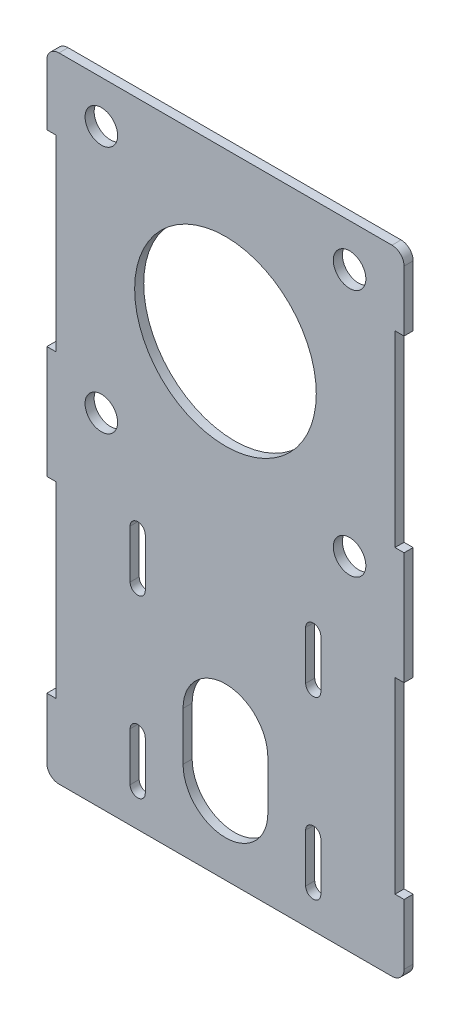
from build123d import *

# Parameters (mm, degrees)
SKETCH1_W          = 187.325
SKETCH1_H          = 332.057083461
EXTRUDE1_DEPTH     = 4.7625
CUT_EXTRUDE1_REACH = 264.098
CUT_EXTRUDE2_REACH = 264.098
SKETCH3_R          = 47.625
SKETCH3_R_2        = 8.5328125
FILLET1_R          = 6.35
CUT_EXTRUDE3_REACH = 264.098
SKETCH4_W          = 4.7625
SKETCH4_H          = 98.425


with BuildPart() as part:
    # Sketch1 → Extrude1 (new body)
    with BuildSketch(Plane.XY):
        with Locations((0, -78.716041731)):
            Rectangle(SKETCH1_W, SKETCH1_H)
    extrude(amount=-EXTRUDE1_DEPTH)

    # Sketch2 → Cut-Extrude1 (cut, up to next)
    with BuildSketch(Plane.XY, mode=Mode.PRIVATE) as cut_extrude1_sk1:
        with BuildLine():
            Line((-22.225, -203.2), (-22.225, -177.8))
            ThreePointArc((-22.225, -177.8), (0, -155.575), (22.225, -177.8))
            Line((22.225, -177.8), (22.225, -203.2))
            ThreePointArc((22.225, -203.2), (0, -225.425), (-22.225, -203.2))
        make_face()
    cut_extrude1_tool1 = extrude(cut_extrude1_sk1.sketch, amount=-CUT_EXTRUDE1_REACH, mode=Mode.PRIVATE) & part.part
    # Sketch2 → Cut-Extrude1 (cut, up to next)
    with BuildSketch(Plane.XY, mode=Mode.PRIVATE) as cut_extrude1_sk2:
        with BuildLine():
            Line((49.99355, -108.9152), (49.99355, -134.3152))
            ThreePointArc((49.99355, -134.3152), (46.0248, -138.28395), (42.05605, -134.3152))
            Line((42.05605, -134.3152), (42.05605, -108.9152))
            ThreePointArc((42.05605, -108.9152), (46.0248, -104.94645), (49.99355, -108.9152))
        make_face()
    cut_extrude1_tool2 = extrude(cut_extrude1_sk2.sketch, amount=-CUT_EXTRUDE1_REACH, mode=Mode.PRIVATE) & part.part
    # Sketch2 → Cut-Extrude1 (cut, up to next)
    with BuildSketch(Plane.XY, mode=Mode.PRIVATE) as cut_extrude1_sk3:
        with BuildLine():
            Line((-42.05605, -108.9152), (-42.05605, -134.3152))
            ThreePointArc((-42.05605, -134.3152), (-46.0248, -138.28395), (-49.99355, -134.3152))
            Line((-49.99355, -134.3152), (-49.99355, -108.9152))
            ThreePointArc((-49.99355, -108.9152), (-46.0248, -104.94645), (-42.05605, -108.9152))
        make_face()
    cut_extrude1_tool3 = extrude(cut_extrude1_sk3.sketch, amount=-CUT_EXTRUDE1_REACH, mode=Mode.PRIVATE) & part.part
    # Sketch2 → Cut-Extrude1 (cut, up to next)
    with BuildSketch(Plane.XY, mode=Mode.PRIVATE) as cut_extrude1_sk4:
        with BuildLine():
            Line((49.99355, -200.9648), (49.99355, -226.3648))
            ThreePointArc((49.99355, -226.3648), (46.0248, -230.33355), (42.05605, -226.3648))
            Line((42.05605, -226.3648), (42.05605, -200.9648))
            ThreePointArc((42.05605, -200.9648), (46.0248, -196.99605), (49.99355, -200.9648))
        make_face()
    cut_extrude1_tool4 = extrude(cut_extrude1_sk4.sketch, amount=-CUT_EXTRUDE1_REACH, mode=Mode.PRIVATE) & part.part
    # Sketch2 → Cut-Extrude1 (cut, up to next)
    with BuildSketch(Plane.XY, mode=Mode.PRIVATE) as cut_extrude1_sk5:
        with BuildLine():
            Line((-42.05605, -200.9648), (-42.05605, -226.3648))
            ThreePointArc((-42.05605, -226.3648), (-46.0248, -230.33355), (-49.99355, -226.3648))
            Line((-49.99355, -226.3648), (-49.99355, -200.9648))
            ThreePointArc((-49.99355, -200.9648), (-46.0248, -196.99605), (-42.05605, -200.9648))
        make_face()
    cut_extrude1_tool5 = extrude(cut_extrude1_sk5.sketch, amount=-CUT_EXTRUDE1_REACH, mode=Mode.PRIVATE) & part.part
    add(cut_extrude1_tool1.solids().sort_by_distance((0, -190.5, 0))[0], mode=Mode.SUBTRACT)
    add(cut_extrude1_tool2.solids().sort_by_distance((46.0248, -121.6152, 0))[0], mode=Mode.SUBTRACT)
    add(cut_extrude1_tool3.solids().sort_by_distance((-46.0248, -121.6152, 0))[0], mode=Mode.SUBTRACT)
    add(cut_extrude1_tool4.solids().sort_by_distance((46.0248, -213.6648, 0))[0], mode=Mode.SUBTRACT)
    add(cut_extrude1_tool5.solids().sort_by_distance((-46.0248, -213.6648, 0))[0], mode=Mode.SUBTRACT)

    # Sketch3 → Cut-Extrude2 (cut, up to next)
    with BuildSketch(Plane(origin=(0, 0, 0), x_dir=(-1, 0, 0), z_dir=(0, 0, -1)), mode=Mode.PRIVATE) as cut_extrude2_sk1:
        Circle(SKETCH3_R)
    cut_extrude2_tool1 = extrude(cut_extrude2_sk1.sketch, amount=CUT_EXTRUDE2_REACH, mode=Mode.PRIVATE) & part.part
    # Sketch3 → Cut-Extrude2 (cut, up to next)
    with BuildSketch(Plane(origin=(0, 0, 0), x_dir=(-1, 0, 0), z_dir=(0, 0, -1)), mode=Mode.PRIVATE) as cut_extrude2_sk2:
        with Locations((65.0875, 65.0875)):
            Circle(SKETCH3_R_2)
    cut_extrude2_tool2 = extrude(cut_extrude2_sk2.sketch, amount=CUT_EXTRUDE2_REACH, mode=Mode.PRIVATE) & part.part
    # Sketch3 → Cut-Extrude2 (cut, up to next)
    with BuildSketch(Plane(origin=(0, 0, 0), x_dir=(-1, 0, 0), z_dir=(0, 0, -1)), mode=Mode.PRIVATE) as cut_extrude2_sk3:
        with Locations((-65.0875, 65.0875)):
            Circle(SKETCH3_R_2)
    cut_extrude2_tool3 = extrude(cut_extrude2_sk3.sketch, amount=CUT_EXTRUDE2_REACH, mode=Mode.PRIVATE) & part.part
    # Sketch3 → Cut-Extrude2 (cut, up to next)
    with BuildSketch(Plane(origin=(0, 0, 0), x_dir=(-1, 0, 0), z_dir=(0, 0, -1)), mode=Mode.PRIVATE) as cut_extrude2_sk4:
        with Locations((-65.0875, -65.0875)):
            Circle(SKETCH3_R_2)
    cut_extrude2_tool4 = extrude(cut_extrude2_sk4.sketch, amount=CUT_EXTRUDE2_REACH, mode=Mode.PRIVATE) & part.part
    # Sketch3 → Cut-Extrude2 (cut, up to next)
    with BuildSketch(Plane(origin=(0, 0, 0), x_dir=(-1, 0, 0), z_dir=(0, 0, -1)), mode=Mode.PRIVATE) as cut_extrude2_sk5:
        with Locations((65.0875, -65.0875)):
            Circle(SKETCH3_R_2)
    cut_extrude2_tool5 = extrude(cut_extrude2_sk5.sketch, amount=CUT_EXTRUDE2_REACH, mode=Mode.PRIVATE) & part.part
    add(cut_extrude2_tool1.solids().sort_by_distance((0, 0, 0))[0], mode=Mode.SUBTRACT)
    add(cut_extrude2_tool2.solids().sort_by_distance((-65.0875, 65.0875, 0))[0], mode=Mode.SUBTRACT)
    add(cut_extrude2_tool3.solids().sort_by_distance((65.0875, 65.0875, 0))[0], mode=Mode.SUBTRACT)
    add(cut_extrude2_tool4.solids().sort_by_distance((65.0875, -65.0875, 0))[0], mode=Mode.SUBTRACT)
    add(cut_extrude2_tool5.solids().sort_by_distance((-65.0875, -65.0875, 0))[0], mode=Mode.SUBTRACT)

    # Fillet1
    fillet1_edges = [part.edges().sort_by_distance(p)[0] for p in [
        (-93.6625, 87.3125, -2.38125),
        (-93.6625, -244.744583461, -2.38125),
        (93.6625, -244.744583461, -2.38125),
        (93.6625, 87.3125, -2.38125),
    ]]
    fillet(fillet1_edges, radius=FILLET1_R)

    # Sketch4 → Cut-Extrude3 (cut, up to next)
    with BuildSketch(Plane(origin=(0, 0, -4.7625), x_dir=(-1, 0, 0), z_dir=(0, 0, -1)), mode=Mode.PRIVATE) as cut_extrude3_sk1:
        with Locations((-91.28125, 0)):
            Rectangle(SKETCH4_W, SKETCH4_H)
    cut_extrude3_tool1 = extrude(cut_extrude3_sk1.sketch, amount=-CUT_EXTRUDE3_REACH, mode=Mode.PRIVATE) & part.part
    # Sketch4 → Cut-Extrude3 (cut, up to next)
    with BuildSketch(Plane(origin=(0, 0, -4.7625), x_dir=(-1, 0, 0), z_dir=(0, 0, -1)), mode=Mode.PRIVATE) as cut_extrude3_sk2:
        with Locations((-91.28125, -157.432083461)):
            Rectangle(SKETCH4_W, SKETCH4_H)
    cut_extrude3_tool2 = extrude(cut_extrude3_sk2.sketch, amount=-CUT_EXTRUDE3_REACH, mode=Mode.PRIVATE) & part.part
    cut_extrude3_1 = cut_extrude3_tool1.solids().sort_by_distance((91.28125, 0, -4.7625))[0]
    add(cut_extrude3_1, mode=Mode.SUBTRACT)
    cut_extrude3_2 = cut_extrude3_tool2.solids().sort_by_distance((91.28125, -157.432083, -4.7625))[0]
    add(cut_extrude3_2, mode=Mode.SUBTRACT)
    cut_extrude3 = cut_extrude3_1 + cut_extrude3_2  # Cut-Extrude3 as one shape, for the pattern or mirror that repeats it

    # Mirror1: Cut-Extrude3 across plane
    add(cut_extrude3.mirror(Plane(origin=(0, 0, 0), x_dir=(0, 0, 1), z_dir=(1, 0, 0))), mode=Mode.SUBTRACT)


solid = part.part
